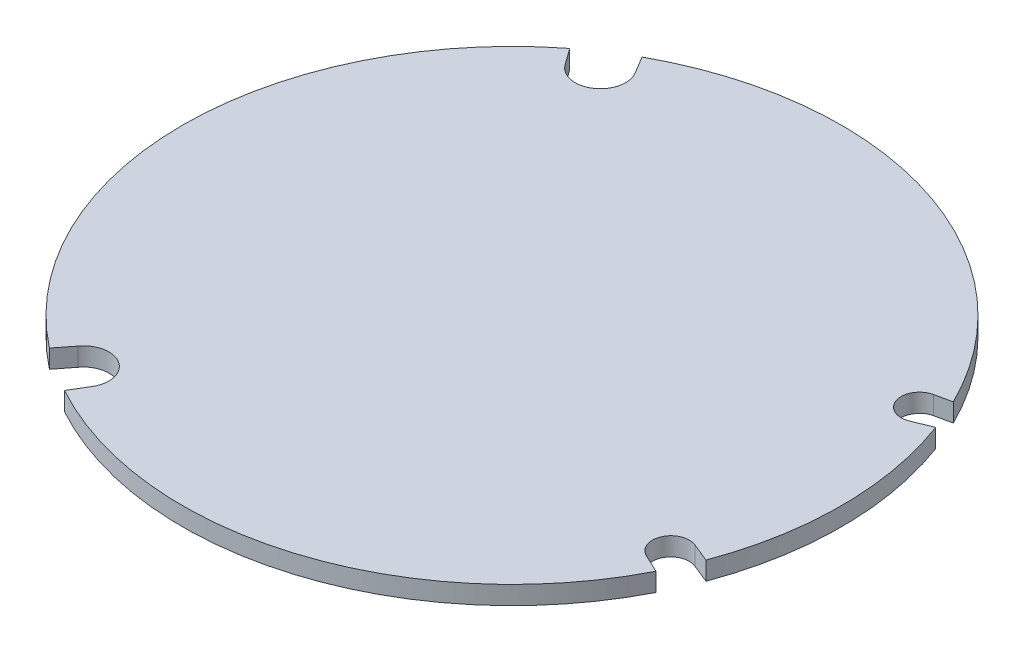
from build123d import *

# Parameters (mm, degrees)
BOSS_EXTRUDE1_DEPTH = 2


with BuildPart() as part:
    # Sketch1 → Boss-Extrude1 (new body)
    with BuildSketch(Plane(origin=(0, 0, 0), x_dir=(1, 0, 0), z_dir=(0, 1, 0))):
        with BuildLine():
            Line((-22.077785671, -28.232551777), (-20.722564452, -26.499526836))
            ThreePointArc((-20.722564452, -26.499526836), (-17.646299114, -25.485845195), (-15.738852042, -28.10359319))
            ThreePointArc((-15.738852042, -28.10359319), (-15.838853197, -28.838444279), (-16.131583768, -29.519851035))
            Line((-16.131583768, -29.519851035), (-17.265479441, -31.407145997))
            ThreePointArc((-17.265479441, -31.407145997), (10.53790538, -34.255775428), (31.932902462, -16.272533311))
            Line((31.932902462, -16.272533311), (29.944803639, -15.328350695))
            ThreePointArc((29.944803639, -15.328350695), (28.971475845, -12.717829506), (31.551909721, -11.667330156))
            Line((31.551909721, -11.667330156), (33.592604626, -12.491697821))
            ThreePointArc((33.592604626, -12.491697821), (35.273676799, -6.34612678), (35.84, 0))
            ThreePointArc((35.84, 0), (35.273676799, 6.34612678), (33.592604626, 12.491697821))
            Line((33.592604626, 12.491697821), (31.551909721, 11.667330156))
            ThreePointArc((31.551909721, 11.667330156), (28.890472027, 12.936059408), (30.384955082, 15.477603213))
            Line((30.384955082, 15.477603213), (32.143137385, 15.853211632))
            ThreePointArc((32.143137385, 15.853211632), (10.761849053, 34.186082036), (-17.265479441, 31.407145997))
            Line((-17.265479441, 31.407145997), (-16.131583768, 29.519851035))
            ThreePointArc((-16.131583768, 29.519851035), (-15.838853197, 28.838444279), (-15.738852042, 28.10359319))
            ThreePointArc((-15.738852042, 28.10359319), (-17.646299114, 25.485845195), (-20.722564452, 26.499526836))
            Line((-20.722564452, 26.499526836), (-22.006824874, 28.287899515))
            ThreePointArc((-22.006824874, 28.287899515), (-35.839971754, 0.044996685), (-22.077785671, -28.232551777))
        make_face()
    extrude(amount=BOSS_EXTRUDE1_DEPTH)


solid = part.part
